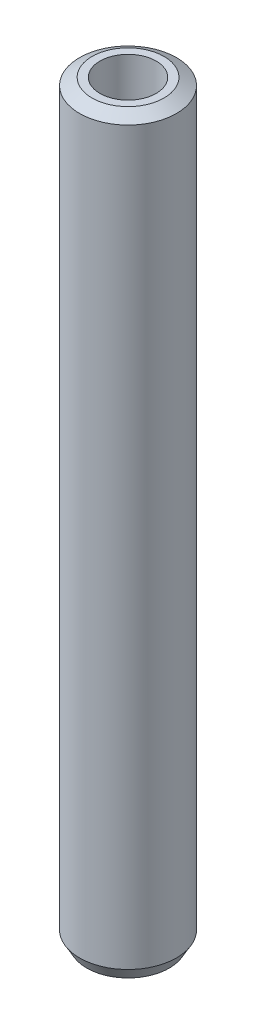
from build123d import *
from OCP.BRepFilletAPI import BRepFilletAPI_MakeChamfer

# Parameters (mm, degrees)
SKETCH1_R           = 37.5
BOSS_EXTRUDE1_DEPTH = 581.080085999
SKETCH2_R           = 21.738666332
CUT_EXTRUDE1_DEPTH  = 584.495129667
CHAMFER1_SIZE       = 5.558109344
CHAMFER1_SIZE2      = 9.626927778


with BuildPart() as part:
    # Sketch1 → Boss-Extrude1 (new body)
    with BuildSketch(Plane(origin=(0, 0, 0), x_dir=(1, 0, 0), z_dir=(0, 1, 0))):
        Circle(SKETCH1_R)
    extrude(amount=BOSS_EXTRUDE1_DEPTH)

    # Sketch2 → Cut-Extrude1 (cut, through all)
    with BuildSketch(Plane(origin=(0, 0, 0), x_dir=(1, 0, 0), z_dir=(0, 1, 0))):
        Circle(SKETCH2_R)
    extrude(amount=CUT_EXTRUDE1_DEPTH, mode=Mode.SUBTRACT)

    # Chamfer1: one chamfer whose edges measure the first distance from different faces: ONE call of the kernel's chamfer builder (chamfer() names one face for all edges)
    chamfer1_edges_1 = [part.edges().sort_by_distance(p)[0] for p in [
        (-37.5, 581.080085999, 0),
    ]]
    chamfer1_side_1 = [part.faces().sort_by_distance(p)[0] for p in [
        (-37.5, 290.540043, 0),
    ]]
    chamfer1_edges_2 = [part.edges().sort_by_distance(p)[0] for p in [
        (-37.5, 0, 0),
    ]]
    chamfer1_side_2 = [part.faces().sort_by_distance(p)[0] for p in [
        (-36.439339828, 0, 0),
    ]]
    chamfer1 = BRepFilletAPI_MakeChamfer(part.part.solid().wrapped)
    for e in chamfer1_edges_1:
        chamfer1.Add(CHAMFER1_SIZE, CHAMFER1_SIZE2, e.wrapped, chamfer1_side_1[0].wrapped)  # the first distance lies on this face
    for e in chamfer1_edges_2:
        chamfer1.Add(CHAMFER1_SIZE, CHAMFER1_SIZE2, e.wrapped, chamfer1_side_2[0].wrapped)  # the first distance lies on this face
    add(Compound.cast(chamfer1.Shape()), mode=Mode.REPLACE)


solid = part.part
